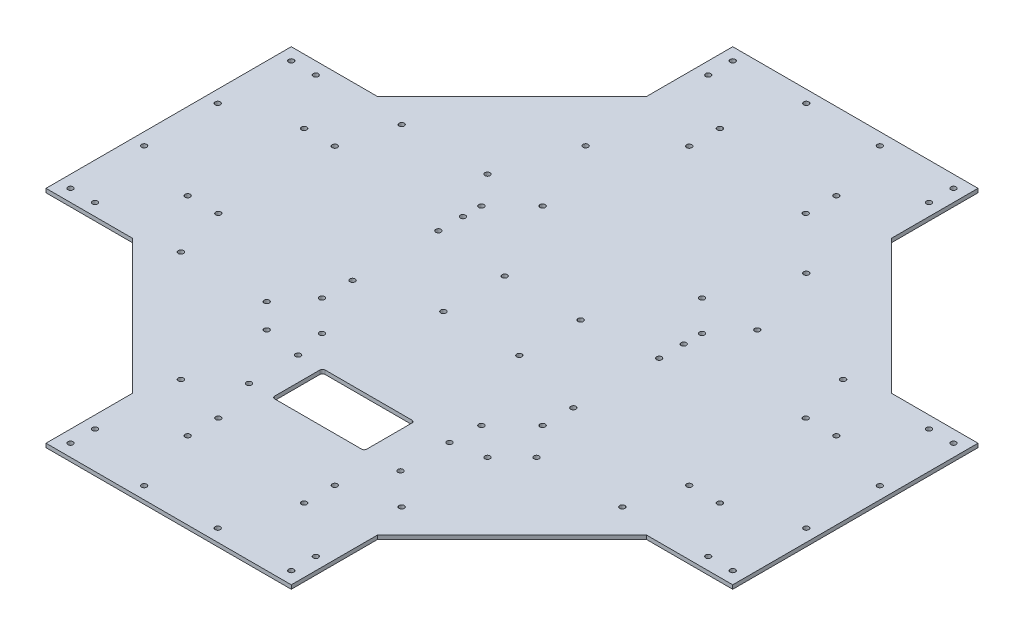
from build123d import *

# Parameters (mm, degrees)
SKETCH1_R           = 2.125
BOSS_EXTRUDE1_DEPTH = 3.175
SKETCH2_R           = 2.125
SKETCH2_W           = 75
SKETCH2_H           = 41
CUT_EXTRUDE1_DEPTH  = 396.992525971
FILLET1_R           = 2


with BuildPart() as part:
    # Sketch1 → Boss-Extrude1 (new body)
    with BuildSketch(Plane(origin=(0, 0, 0), x_dir=(1, 0, 0), z_dir=(0, 1, 0))):
        Polygon((-100, -280), (0, -280), (100, -280), (100, -209.601551084), (209.601551084, -100), (280, -100), (280, 0), (280, 100), (209.601551084, 100), (100, 209.601551084), (100, 280), (0, 280), (-100, 280), (-100, 209.601551084), (-209.601551084, 100), (-280, 100), (-280, 0), (-280, -100), (-209.601551084, -100), (-100, -209.601551084), align=None)
        with Locations((-90, -270)):
            Circle(SKETCH1_R, mode=Mode.SUBTRACT)
        with Locations((-90, -250)):
            Circle(SKETCH1_R, mode=Mode.SUBTRACT)
        with Locations((-30, -270)):
            Circle(SKETCH1_R, mode=Mode.SUBTRACT)
        with Locations((-47.5, -217)):
            Circle(SKETCH1_R, mode=Mode.SUBTRACT)
        with Locations((-90, -180)):
            Circle(SKETCH1_R, mode=Mode.SUBTRACT)
        with Locations((-47.5, -192)):
            Circle(SKETCH1_R, mode=Mode.SUBTRACT)
        with Locations((-270, -90)):
            Circle(SKETCH1_R, mode=Mode.SUBTRACT)
        with Locations((-250, -90)):
            Circle(SKETCH1_R, mode=Mode.SUBTRACT)
        with Locations((-180, -90)):
            Circle(SKETCH1_R, mode=Mode.SUBTRACT)
        with Locations((-217, -47.5)):
            Circle(SKETCH1_R, mode=Mode.SUBTRACT)
        with Locations((-270, -30)):
            Circle(SKETCH1_R, mode=Mode.SUBTRACT)
        with Locations((-192, -47.5)):
            Circle(SKETCH1_R, mode=Mode.SUBTRACT)
        with Locations((-90, -110)):
            Circle(SKETCH1_R, mode=Mode.SUBTRACT)
        with Locations((-110, -90)):
            Circle(SKETCH1_R, mode=Mode.SUBTRACT)
        with Locations((-90, -40)):
            Circle(SKETCH1_R, mode=Mode.SUBTRACT)
        with Locations((30, -270)):
            Circle(SKETCH1_R, mode=Mode.SUBTRACT)
        with Locations((47.5, -217)):
            Circle(SKETCH1_R, mode=Mode.SUBTRACT)
        with Locations((90, -270)):
            Circle(SKETCH1_R, mode=Mode.SUBTRACT)
        with Locations((90, -250)):
            Circle(SKETCH1_R, mode=Mode.SUBTRACT)
        with Locations((47.5, -192)):
            Circle(SKETCH1_R, mode=Mode.SUBTRACT)
        with Locations((90, -180)):
            Circle(SKETCH1_R, mode=Mode.SUBTRACT)
        with Locations((90, -110)):
            Circle(SKETCH1_R, mode=Mode.SUBTRACT)
        with Locations((110, -90)):
            Circle(SKETCH1_R, mode=Mode.SUBTRACT)
        with Locations((90, -40)):
            Circle(SKETCH1_R, mode=Mode.SUBTRACT)
        with Locations((180, -90)):
            Circle(SKETCH1_R, mode=Mode.SUBTRACT)
        with Locations((250, -90)):
            Circle(SKETCH1_R, mode=Mode.SUBTRACT)
        with Locations((270, -90)):
            Circle(SKETCH1_R, mode=Mode.SUBTRACT)
        with Locations((192, -47.5)):
            Circle(SKETCH1_R, mode=Mode.SUBTRACT)
        with Locations((217, -47.5)):
            Circle(SKETCH1_R, mode=Mode.SUBTRACT)
        with Locations((270, -30)):
            Circle(SKETCH1_R, mode=Mode.SUBTRACT)
        with Locations((-270, 30)):
            Circle(SKETCH1_R, mode=Mode.SUBTRACT)
        with Locations((-217, 47.5)):
            Circle(SKETCH1_R, mode=Mode.SUBTRACT)
        with Locations((-192, 47.5)):
            Circle(SKETCH1_R, mode=Mode.SUBTRACT)
        with Locations((-270, 90)):
            Circle(SKETCH1_R, mode=Mode.SUBTRACT)
        with Locations((-250, 90)):
            Circle(SKETCH1_R, mode=Mode.SUBTRACT)
        with Locations((-180, 90)):
            Circle(SKETCH1_R, mode=Mode.SUBTRACT)
        with Locations((-90, 30)):
            Circle(SKETCH1_R, mode=Mode.SUBTRACT)
        with Locations((-90, 50)):
            Circle(SKETCH1_R, mode=Mode.SUBTRACT)
        with Locations((-110, 90)):
            Circle(SKETCH1_R, mode=Mode.SUBTRACT)
        with Locations((-90, 150)):
            Circle(SKETCH1_R, mode=Mode.SUBTRACT)
        with Locations((-47.5, 192)):
            Circle(SKETCH1_R, mode=Mode.SUBTRACT)
        with Locations((-90, 250)):
            Circle(SKETCH1_R, mode=Mode.SUBTRACT)
        with Locations((-90, 270)):
            Circle(SKETCH1_R, mode=Mode.SUBTRACT)
        with Locations((-47.5, 217)):
            Circle(SKETCH1_R, mode=Mode.SUBTRACT)
        with Locations((-30, 270)):
            Circle(SKETCH1_R, mode=Mode.SUBTRACT)
        with Locations((90, 30)):
            Circle(SKETCH1_R, mode=Mode.SUBTRACT)
        with Locations((90, 50)):
            Circle(SKETCH1_R, mode=Mode.SUBTRACT)
        with Locations((110, 90)):
            Circle(SKETCH1_R, mode=Mode.SUBTRACT)
        with Locations((192, 47.5)):
            Circle(SKETCH1_R, mode=Mode.SUBTRACT)
        with Locations((270, 30)):
            Circle(SKETCH1_R, mode=Mode.SUBTRACT)
        with Locations((217, 47.5)):
            Circle(SKETCH1_R, mode=Mode.SUBTRACT)
        with Locations((180, 90)):
            Circle(SKETCH1_R, mode=Mode.SUBTRACT)
        with Locations((250, 90)):
            Circle(SKETCH1_R, mode=Mode.SUBTRACT)
        with Locations((270, 90)):
            Circle(SKETCH1_R, mode=Mode.SUBTRACT)
        with Locations((47.5, 192)):
            Circle(SKETCH1_R, mode=Mode.SUBTRACT)
        with Locations((90, 150)):
            Circle(SKETCH1_R, mode=Mode.SUBTRACT)
        with Locations((47.5, 217)):
            Circle(SKETCH1_R, mode=Mode.SUBTRACT)
        with Locations((30, 270)):
            Circle(SKETCH1_R, mode=Mode.SUBTRACT)
        with Locations((90, 250)):
            Circle(SKETCH1_R, mode=Mode.SUBTRACT)
        with Locations((90, 270)):
            Circle(SKETCH1_R, mode=Mode.SUBTRACT)
    extrude(amount=BOSS_EXTRUDE1_DEPTH)

    # Sketch2 → Cut-Extrude1 (cut, through all)
    with BuildSketch(Plane(origin=(0, 3.175, 0), x_dir=(1, 0, 0), z_dir=(0, 1, 0))):
        with Locations((-31, 25)):
            Circle(SKETCH2_R)
        with Locations((-31, -25)):
            Circle(SKETCH2_R)
        with Locations((31, -25)):
            Circle(SKETCH2_R)
        with Locations((31, 25)):
            Circle(SKETCH2_R)
        with Locations((-90, 65)):
            Circle(SKETCH2_R)
        with Locations((-65, 90)):
            Circle(SKETCH2_R)
        with Locations((65, 90)):
            Circle(SKETCH2_R)
        with Locations((90, 65)):
            Circle(SKETCH2_R)
        with Locations((90, -65)):
            Circle(SKETCH2_R)
        with Locations((65, -90)):
            Circle(SKETCH2_R)
        with Locations((-65, -90)):
            Circle(SKETCH2_R)
        with Locations((-90, -65)):
            Circle(SKETCH2_R)
        with Locations((64.065141092, -115)):
            Circle(SKETCH2_R)
        with Locations((64.065141092, -155)):
            Circle(SKETCH2_R)
        with Locations((-59.434858908, -115)):
            Circle(SKETCH2_R)
        with Locations((-59.434858908, -155)):
            Circle(SKETCH2_R)
        with Locations((-2.534858908, -135)):
            Rectangle(SKETCH2_W, SKETCH2_H)
    extrude(amount=-CUT_EXTRUDE1_DEPTH, mode=Mode.SUBTRACT)

    # Fillet1
    fillet1_edges = [part.edges().sort_by_distance(p)[0] for p in [
        (34.965141092, 1.5875, 114.5),
        (34.965141092, 1.5875, 155.5),
        (-40.034858908, 1.5875, 155.5),
        (-40.034858908, 1.5875, 114.5),
    ]]
    fillet(fillet1_edges, radius=FILLET1_R)


solid = part.part
